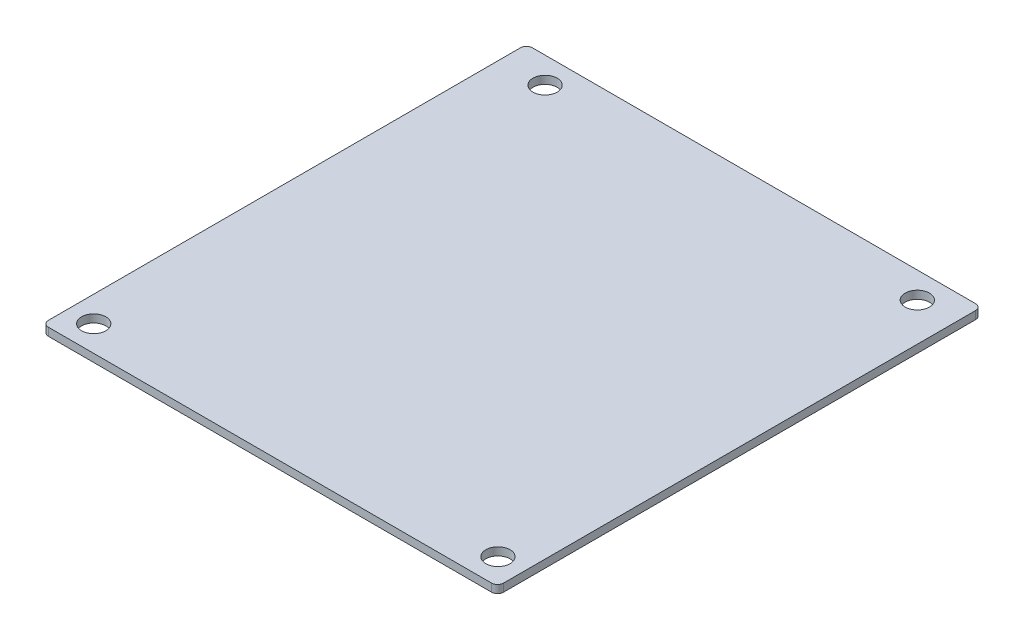
from build123d import *

# Parameters (mm, degrees)
SKETCH1_W           = 90.17
SKETCH1_H           = 95.89
BOSS_EXTRUDE1_DEPTH = 1.57
SKETCH3_R           = 2.4
CUT_EXTRUDE2_DEPTH  = 1.57
FILLET10_R          = 1.2
FILLET11_R          = 1.2
FILLET14_R          = 1.2
FILLET21_R          = 1.2


with BuildPart() as part:
    # Sketch1 → Boss-Extrude1 (new body)
    with BuildSketch(Plane(origin=(0, 0, 0), x_dir=(1, 0, 0), z_dir=(0, 1, 0))):
        Rectangle(SKETCH1_W, SKETCH1_H)
    extrude(amount=BOSS_EXTRUDE1_DEPTH)

    # Sketch3 → Cut-Extrude2 (cut)
    with BuildSketch(Plane(origin=(0, 1.57, 0), x_dir=(1, 0, 0), z_dir=(0, 1, 0))):
        with Locations((-40.005, -42.865)):
            Circle(SKETCH3_R)
        with Locations((40.005, -42.785)):
            Circle(SKETCH3_R)
        with Locations((-36.235, 42.785)):
            Circle(SKETCH3_R)
        with Locations((37.515, 42.785)):
            Circle(SKETCH3_R)
    extrude(amount=-CUT_EXTRUDE2_DEPTH, mode=Mode.SUBTRACT)

    # Fillet10
    fillet10_edges = [part.edges().sort_by_distance(p)[0] for p in [
        (45.085, 0.785, 47.945),
    ]]
    fillet(fillet10_edges, radius=FILLET10_R)

    # Fillet11
    fillet11_edges = [part.edges().sort_by_distance(p)[0] for p in [
        (45.085, 0.785, -47.945),
    ]]
    fillet(fillet11_edges, radius=FILLET11_R)

    # Fillet14
    fillet14_edges = [part.edges().sort_by_distance(p)[0] for p in [
        (-45.085, 0.785, -47.945),
    ]]
    fillet(fillet14_edges, radius=FILLET14_R)

    # Fillet21
    fillet21_edges = [part.edges().sort_by_distance(p)[0] for p in [
        (-45.085, 0.785, 47.945),
    ]]
    fillet(fillet21_edges, radius=FILLET21_R)


solid = part.part
